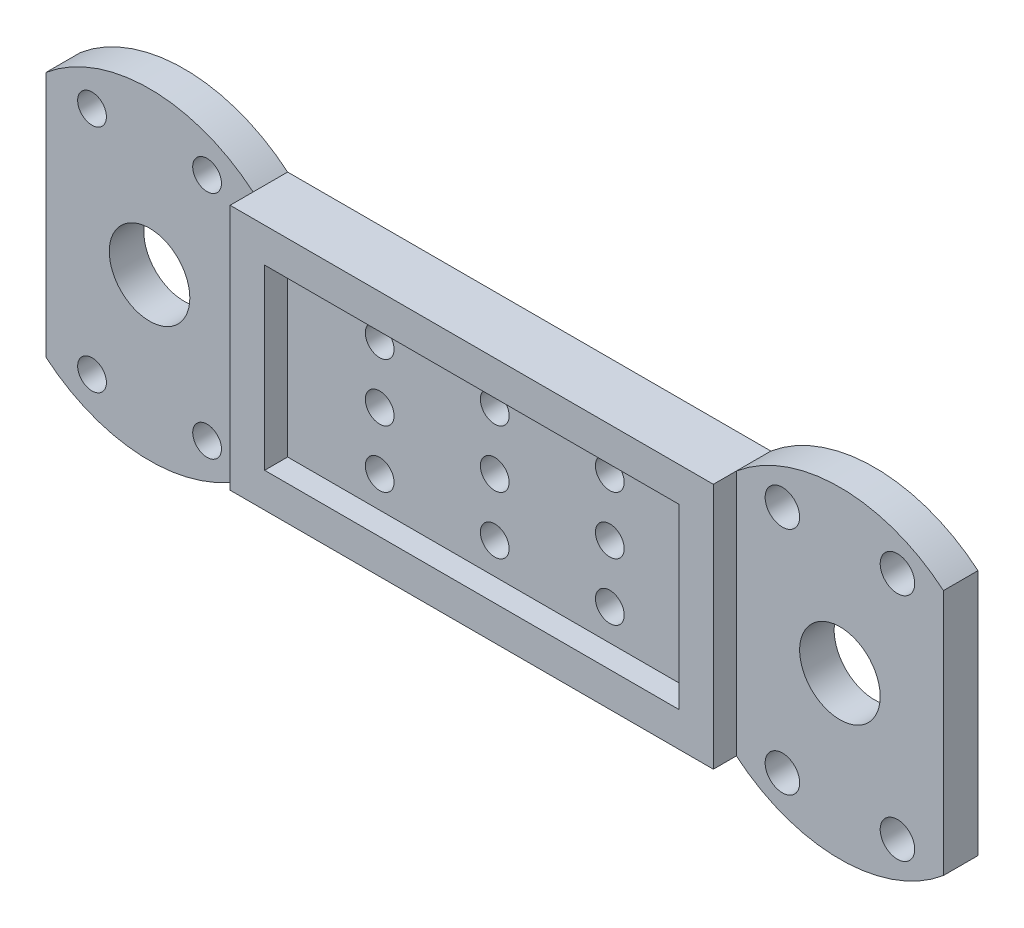
from build123d import *

# Parameters (mm, degrees)
SKETCH1_R           = 3.5
SKETCH1_R_2         = 1.25
SKETCH1_R_3         = 1.5
BOSS_EXTRUDE1_DEPTH = 3
SKETCH2_W           = 42
SKETCH2_H           = 21.44761059
SKETCH2_W_2         = 36
SKETCH2_H_2         = 15.44761059
BOSS_EXTRUDE2_DEPTH = 2


with BuildPart() as part:
    # Sketch1 → Boss-Extrude1 (new body)
    with BuildSketch(Plane.XY):
        with BuildLine():
            Line((-9, 10.723805295), (-9, -10.723805295))
            ThreePointArc((-9, -10.723805295), (0, -14), (9, -10.723805295))
            Line((9, -10.723805295), (51, -10.723805295))
            ThreePointArc((51, -10.723805295), (60, -14), (69, -10.723805295))
            Line((69, -10.723805295), (69, 10.723805295))
            ThreePointArc((69, 10.723805295), (60, 14), (51, 10.723805295))
            Line((51, 10.723805295), (9, 10.723805295))
            ThreePointArc((9, 10.723805295), (0, 14), (-9, 10.723805295))
        make_face()
        Circle(SKETCH1_R, mode=Mode.SUBTRACT)
        with Locations((-5, 10)):
            Circle(SKETCH1_R_2, mode=Mode.SUBTRACT)
        with Locations((5, 10)):
            Circle(SKETCH1_R_2, mode=Mode.SUBTRACT)
        with Locations((-5, -10)):
            Circle(SKETCH1_R_2, mode=Mode.SUBTRACT)
        with Locations((5, -10)):
            Circle(SKETCH1_R_2, mode=Mode.SUBTRACT)
        with Locations((60, 0)):
            Circle(SKETCH1_R, mode=Mode.SUBTRACT)
        with Locations((55, 10)):
            Circle(SKETCH1_R_3, mode=Mode.SUBTRACT)
        with Locations((65, 10)):
            Circle(SKETCH1_R_3, mode=Mode.SUBTRACT)
        with Locations((55, -10)):
            Circle(SKETCH1_R_3, mode=Mode.SUBTRACT)
        with Locations((65, -10)):
            Circle(SKETCH1_R_3, mode=Mode.SUBTRACT)
        with Locations((30, 0)):
            Circle(SKETCH1_R_2, mode=Mode.SUBTRACT)
        with Locations((30, 5)):
            Circle(SKETCH1_R_2, mode=Mode.SUBTRACT)
        with Locations((30, -5)):
            Circle(SKETCH1_R_2, mode=Mode.SUBTRACT)
        with Locations((40, 0)):
            Circle(SKETCH1_R_2, mode=Mode.SUBTRACT)
        with Locations((20, 0)):
            Circle(SKETCH1_R_2, mode=Mode.SUBTRACT)
        with Locations((40, 5)):
            Circle(SKETCH1_R_2, mode=Mode.SUBTRACT)
        with Locations((40, -5)):
            Circle(SKETCH1_R_2, mode=Mode.SUBTRACT)
        with Locations((20, -5)):
            Circle(SKETCH1_R_2, mode=Mode.SUBTRACT)
        with Locations((20, 5)):
            Circle(SKETCH1_R_2, mode=Mode.SUBTRACT)
    extrude(amount=BOSS_EXTRUDE1_DEPTH)

    # Sketch2 → Boss-Extrude2 (add)
    with BuildSketch(Plane(origin=(0, 0, 3), x_dir=(-1, 0, 0), z_dir=(0, 0, -1))):
        with Locations((-30, 0)):
            Rectangle(SKETCH2_W, SKETCH2_H)
        with Locations((-30, 0)):
            Rectangle(SKETCH2_W_2, SKETCH2_H_2, mode=Mode.SUBTRACT)
    extrude(amount=-BOSS_EXTRUDE2_DEPTH)


solid = part.part
